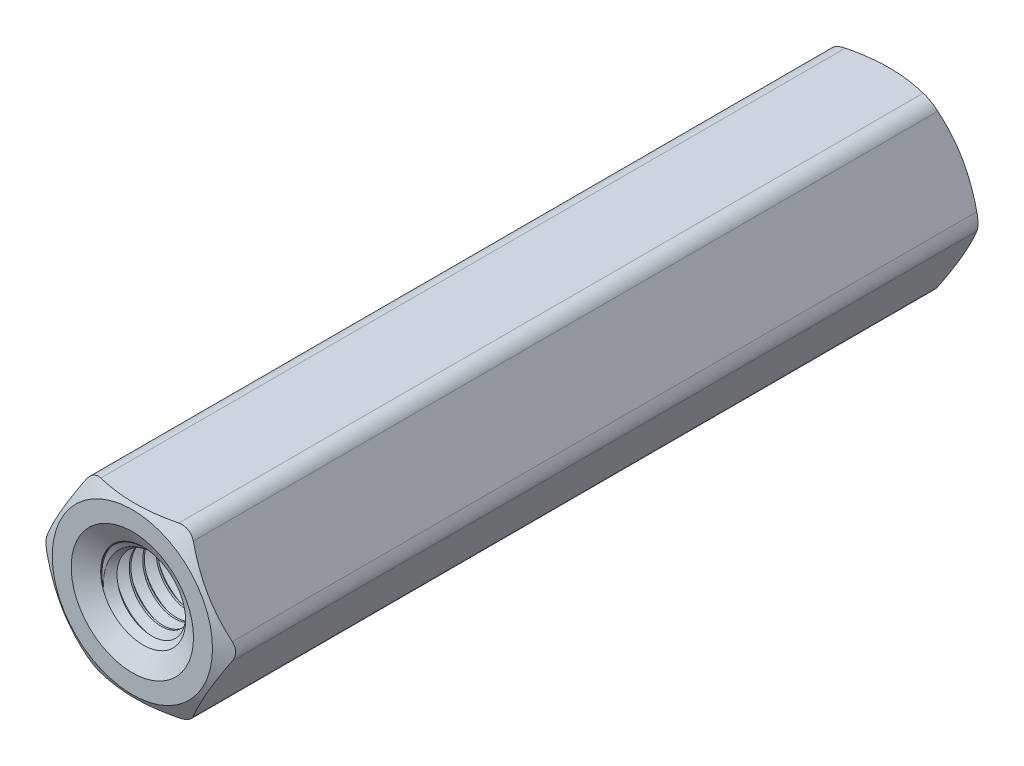
from build123d import *

# Parameters (mm, degrees)
SKETCH4_R              = 3.75
BOSS_EXTRUDE1_DEPTH    = 22.5
SKETCH5_OUTSIDE_W      = 184.63
SKETCH5_OUTSIDE_H      = 183.082
SKETCH5_OUTSIDE_R      = 4.75
CUT_EXTRUDE1_DEPTH     = 46.643546459
CUT_EXTRUDE1_DRAFT     = -60
SKETCH6_OUTSIDE_W      = 184.63
SKETCH6_OUTSIDE_H      = 183.082
SKETCH6_OUTSIDE_R      = 4.75
CUT_EXTRUDE2_DEPTH     = 46.643546459
CUT_EXTRUDE2_DRAFT     = -60
FILLET1_R              = 1
BOSS_EXTRUDE2_START    = -22.5
SKETCH7_R              = 3.625
BOSS_EXTRUDE2_DEPTH    = 12.7
SKETCH8_W              = 12.7
SKETCH8_H              = 2.5
CUT_SWEEP1_PITCH       = 0.8
CUT_SWEEP1_HEIGHT      = 10.4
CUT_SWEEP1_RADIUS      = 2.5
CUT_SWEEP1_START_ANGLE = 90
LPATTERN1_COUNT        = 2
LPATTERN1_PITCH        = 8.8
CIRPATTERN1_COUNT      = 2


with BuildPart() as part:
    # Sketch3 → Revolve1 (revolve)
    with BuildSketch(Plane(origin=(0, 0, 0), x_dir=(0, 0, -1), z_dir=(1, 0, 0))):
        Polygon((-21.850480947, 2.5), (-9.8, 2.5), (-9.8, 0), (9.8, 0), (9.8, 2.5), (21.850480947, 2.5), (22.5, 3.625), (22.5, 5), (0, 5), (-22.5, 5), (-22.5, 3.625), align=None)
        Polygon((-21.850480947, 2.5), (-9.8, 2.5), (-9.8, 0), (9.8, 0), (9.8, 2.5), (21.850480947, 2.5), (22.5, 3.625), (22.5, 5), (0, 5), (-22.5, 5), (-22.5, 3.625), align=None)
    revolve(axis=Axis((0, 0, 9.8), (0, 0, 1)))

    # Sketch4 → Boss-Extrude1 (add, symmetric)
    with BuildSketch(Plane.XY):
        Polygon((-2.886751346, 5), (-5.773502692, 0), (-2.886751346, -5), (2.886751346, -5), (5.773502692, 0), (2.886751346, 5), align=None)
        Circle(SKETCH4_R, mode=Mode.SUBTRACT)
    extrude(amount=BOSS_EXTRUDE1_DEPTH, both=True)


with BuildPart() as cut_extrude1_tool:
    # Sketch5 outside → Cut-Extrude1 (with draft: the straight prism first)
    with BuildSketch(Plane.XY.offset(22.5)):
        Rectangle(SKETCH5_OUTSIDE_W, SKETCH5_OUTSIDE_H)
        Circle(SKETCH5_OUTSIDE_R, mode=Mode.SUBTRACT)
    extrude(amount=-CUT_EXTRUDE1_DEPTH)
    # Cut-Extrude1: the draft: its side faces are tilted about the plane it starts from
    cut_extrude1_sides = [cut_extrude1_tool.faces().sort_by_distance(p)[0] for p in [
        (0, -91.541, -0.821773229),
        (92.315, 0, -0.821773229),
        (0, 91.541, -0.821773229),
        (-92.315, 0, -0.821773229),
        (-4.75, 0, -0.821773229),
    ]]
    draft(cut_extrude1_sides, Plane.XY.offset(22.5), CUT_EXTRUDE1_DRAFT)


with BuildPart() as part_1:
    add(part.part)

    # Cut-Extrude1: cut by cut_extrude1_tool
    add(cut_extrude1_tool.part, mode=Mode.SUBTRACT)


with BuildPart() as cut_extrude2_tool:
    # Sketch6 outside → Cut-Extrude2 (with draft: the straight prism first)
    with BuildSketch(Plane(origin=(0, 0, -22.5), x_dir=(-1, 0, 0), z_dir=(0, 0, -1))):
        Rectangle(SKETCH6_OUTSIDE_W, SKETCH6_OUTSIDE_H)
        Circle(SKETCH6_OUTSIDE_R, mode=Mode.SUBTRACT)
    extrude(amount=-CUT_EXTRUDE2_DEPTH)
    # Cut-Extrude2: the draft: its side faces are tilted about the plane it starts from
    cut_extrude2_sides = [cut_extrude2_tool.faces().sort_by_distance(p)[0] for p in [
        (0, -91.541, 0.821773229),
        (-92.315, 0, 0.821773229),
        (0, 91.541, 0.821773229),
        (92.315, 0, 0.821773229),
        (4.75, 0, 0.821773229),
    ]]
    draft(cut_extrude2_sides, Plane(origin=(0, 0, -22.5), x_dir=(-1, 0, 0), z_dir=(0, 0, -1)), CUT_EXTRUDE2_DRAFT)


with BuildPart() as part_2:
    add(part_1.part)

    # Cut-Extrude2: cut by cut_extrude2_tool
    add(cut_extrude2_tool.part, mode=Mode.SUBTRACT)

    # Fillet1
    # the kernel refuses this fillet: 1 mm, written as the material it takes off along each edge
    with BuildSketch(Plane(origin=(2.886751346, 5, 23.352456118), x_dir=(-1, 0, 0), z_dir=(0, 0, -1)), Plane(origin=(-2.886751346, 5, 23.352456118), x_dir=(-0.4999999999999997, -0.8660254037844388, 0), z_dir=(0, 0, -1))) as fillet1_piece_1:
        with BuildLine():
            CenterArc((FILLET1_R * 0.57735026919, -FILLET1_R), FILLET1_R, 90, 60)
            Line((-FILLET1_R * 0.288675134595, -FILLET1_R * 0.5), (0, 0))
            Line((0, 0), (FILLET1_R * 0.57735026919, 0))
        make_face()
    extrude(amount=46.704912237, mode=Mode.SUBTRACT)
    with BuildSketch(Plane(origin=(-5.773502692, 0, -23.352456118), x_dir=(0.5000000000000001, -0.8660254037844386, 0), z_dir=(0, 0, 1)), Plane(origin=(-2.886751346, -5, -23.352456118), x_dir=(1, 0, 0), z_dir=(0, 0, 1)), Plane(origin=(2.886751346, -5, -23.352456118), x_dir=(0.5000000000000002, 0.8660254037844386, 0), z_dir=(0, 0, 1)), Plane(origin=(5.773502692, 0, 23.352456118), x_dir=(-0.4999999999999997, -0.8660254037844388, 0), z_dir=(0, 0, -1))) as fillet1_piece_2:
        with BuildLine():
            CenterArc((FILLET1_R * 0.57735026919, FILLET1_R), FILLET1_R, 210, 60)
            Line((-FILLET1_R * 0.288675134595, FILLET1_R * 0.5), (0, 0))
            Line((0, 0), (FILLET1_R * 0.57735026919, 0))
        make_face()
    extrude(amount=46.704912237, mode=Mode.SUBTRACT)

    # Sketch7 → Boss-Extrude2 (add)
    with BuildSketch(Plane(origin=(0, 0, 0), x_dir=(-1, 0, 0), z_dir=(0, 0, -1)).offset(BOSS_EXTRUDE2_START)):
        Circle(SKETCH7_R)
    extrude(amount=BOSS_EXTRUDE2_DEPTH)

    # SurfaceCut1
    split(bisect_by=Plane.XY, keep=Keep.TOP)


with BuildPart() as body_2:
    # Sketch8 → Revolve2 (revolve)
    with BuildSketch(Plane(origin=(0, 0, 0), x_dir=(0, 0, -1), z_dir=(1, 0, 0))):
        with Locations((-16.15, 1.25)):
            Rectangle(SKETCH8_W, SKETCH8_H)
    revolve(axis=Axis((0, 0, 9.8), (0, 0, 1)))

    # Cut-Sweep1: sweep along a helix
    with BuildLine() as cut_sweep1_path:
        add(Helix(CUT_SWEEP1_PITCH, CUT_SWEEP1_HEIGHT, CUT_SWEEP1_RADIUS, center=(0, 0, 22.5), direction=(0, 0, -1), mode=Mode.PRIVATE).rotate(Axis((0, 0, 22.5), (0, 0, -1)), CUT_SWEEP1_START_ANGLE))
    # Sketch10 → Cut-Sweep1 (sweep, cut)
    with BuildSketch(Plane(origin=(0, 0, 0), x_dir=(0, 0, -1), z_dir=(1, 0, 0))):
        Polygon((-22.9, 1.980384758), (-22.8, 1.980384758), (-22.475, 2.54330127), (-23.225, 2.54330127), align=None)
    cut_sweep1 = sweep(path=cut_sweep1_path.line, is_frenet=True, mode=Mode.SUBTRACT)

    # LPattern1: Cut-Sweep1 ×2
    with Locations(*[(0, 0, -i * LPATTERN1_PITCH) for i in range(1, LPATTERN1_COUNT)]):
        add(cut_sweep1, mode=Mode.SUBTRACT)


with BuildPart() as part_3:
    add(part_2.part)

    # Combine1: cut body 2
    add(body_2.part, mode=Mode.SUBTRACT)

    # Cut-Extrude3 cone 1 section (through the dimple's axis) → Cut-Extrude3 (revolve, cut)
    with BuildSketch(Plane(origin=(0, 0, 22.5), x_dir=(0, -1, 0), z_dir=(1, 0, 0))):
        Polygon((0, 0), (3.625, 0), (0, 2.092894726), align=None)
    revolve(axis=Axis((0, 0, 22.5), (0, 0, -1)), mode=Mode.SUBTRACT)

    # Cut-Extrude4 cone 1 section (through the dimple's axis) → Cut-Extrude4 (revolve, cut)
    with BuildSketch(Plane(origin=(0, 0, 21.893782217), x_dir=(0, -1, 0), z_dir=(1, 0, 0))):
        Polygon((0, 0), (2.5508, 0), (0, 2.5508), align=None)
    revolve(axis=Axis((0, 0, 21.893782217), (0, 0, -1)), mode=Mode.SUBTRACT)


with BuildPart() as cirpattern1_1:
    # CirPattern1: pattern copy
    add(part_3.part.rotate(Axis((0, 0, 0), (1, 0, 0)), 1 * 360 / CIRPATTERN1_COUNT))


with BuildPart() as part_4:
    add(part_3.part)

    # Combine2: union CirPattern1_1
    add(cirpattern1_1.part)


solid = part_4.part
